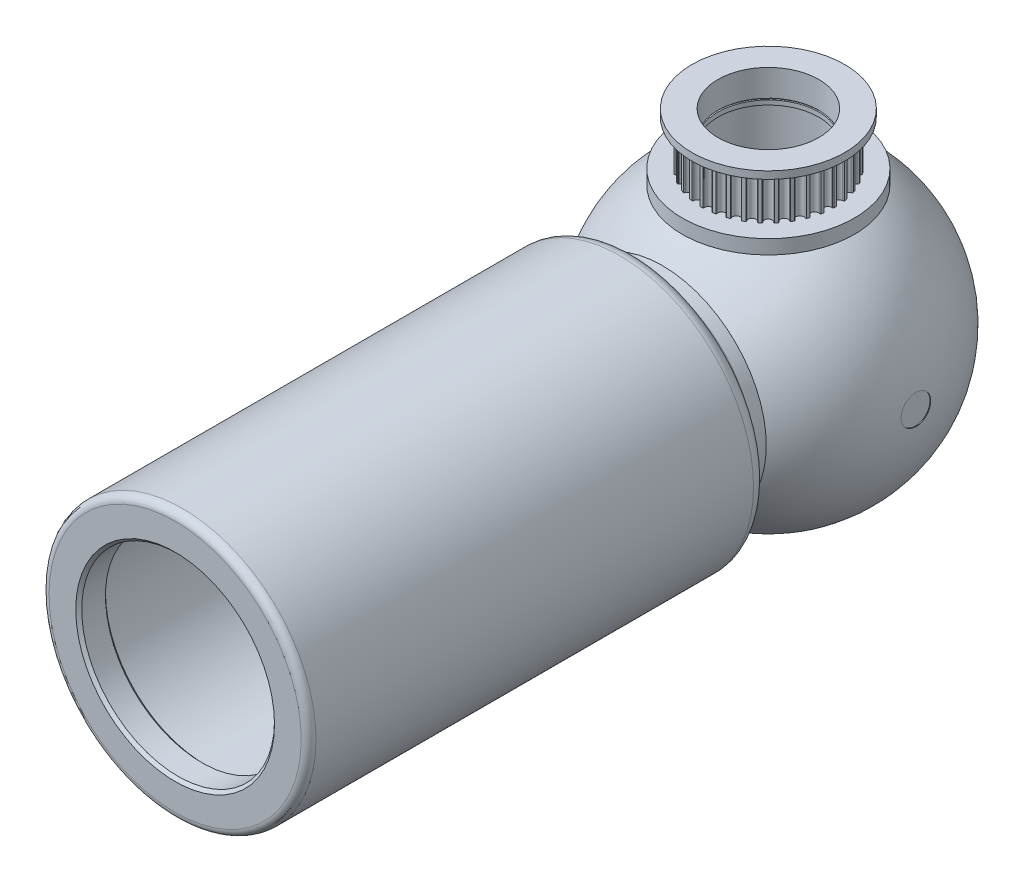
from build123d import *

# Parameters (mm, degrees)
SKETCH4_R           = 45.150000000000006
EXTRUDE3_DEPTH      = 30
EXTRUDE4_DEPTH      = 30
CIRPATTERN1_COUNT   = 36
SKETCH5_R           = 51.5
EXTRUDE5_DEPTH      = 5
EXTRUDE6_REACH      = 258.665
EXTRUDE6_END_RADIUS = 100
SKETCH11_R          = 70.00000000000001
SKETCH12_R          = 90
EXTRUDE7_DEPTH      = 10
EXTRUDE8_START      = 300
SKETCH13_R          = 90.00000000000001
SKETCH13_R_2        = 75.00000000000001
EXTRUDE8_DEPTH      = 300
FILLET1_R           = 10
SKETCH14_R          = 75.00000000000004
SKETCH14_R_2        = 65
EXTRUDE9_DEPTH      = 20
FILLET2_R           = 5
CHAMFER2_SIZE       = 2
SKETCH15_R          = 10.000000000000004
CUT_EXTRUDE1_DEPTH  = 1


with BuildPart() as part:
    # Sketch1 → Revolve1 (revolve)
    with BuildSketch(Plane.XY, mode=Mode.PRIVATE) as revolve1_sk:
        with BuildLine():
            Line((57.99999999999998, 81.46164741766522), (57.99999999999998, 91.00445492000001))
            Line((57.99999999999998, 91.00445492000001), (-2.339e-14, 91.00445492))
            Line((-2.339e-14, 91.00445492), (2.204e-14, -100))
            ThreePointArc((2.204e-14, -100), (95.25272894192199, -30.44532195784334), (57.99999999999998, 81.46164741766522))
        make_face()
    revolve(revolve1_sk.sketch.rotate(Axis((-2.339e-14, 91.00445492, 0), (2.4e-16, -1, 0)), 180), axis=Axis((-2.339e-14, 91.00445492, 0), (2.4e-16, -1, 0)))

    # Sketch4 → Extrude3 (add)
    with BuildSketch(Plane(origin=(-2.165e-14, 91.00445491999999, 0), x_dir=(1, 2.4e-16, 0), z_dir=(-2.4e-16, 1, 0))):
        with Locations(Location((0, 0, 0), (0, 0, 180))):
            Circle(SKETCH4_R)
    extrude(amount=EXTRUDE3_DEPTH)

    # Sketch3 → Extrude4 (cut)
    with BuildSketch(Plane(origin=(-2.165e-14, 91.00445491999999, 0), x_dir=(1, 2.4e-16, 0), z_dir=(-2.4e-16, 1, 0))):
        with BuildLine():
            Line((-1.2656108048172179, 44.394558922616696), (-1.2821062891524753, 43.922190055167896))
            ThreePointArc((-1.2821062891524753, 43.922190055167896), (-3.6265504557300683, 41.45166138759755), (-6.364380048477421, 43.477548716291686))
            Line((-6.364380048477421, 43.477548716291686), (-6.4626509223595505, 43.93987682844231))
            ThreePointArc((-6.4626509223595505, 43.93987682844231), (-6.785899963415481, 44.421956093074286), (-7.352628199224167, 44.54729350436426))
            ThreePointArc((-7.352628199224167, 44.54729350436426), (-3.935081785056771, 44.97819061884231), (-0.4946310814146013, 45.14729050666605))
            ThreePointArc((-0.4946310814146013, 45.14729050666605), (-1.0309848288259285, 44.92544592690464), (-1.2656108048172179, 44.394558922616696))
        make_face()
    extrude4 = extrude(amount=EXTRUDE4_DEPTH, mode=Mode.SUBTRACT)

    # CirPattern1: Extrude4 ×36 about axis
    cirpattern1_axis = Axis((0.00928462633456735, 0, 0.10612376461600313), (0, 1, 0))
    for i in range(1, CIRPATTERN1_COUNT):
        add(extrude4.rotate(cirpattern1_axis, i * 360 / CIRPATTERN1_COUNT), mode=Mode.SUBTRACT)

    # Sketch5 → Extrude5 (add)
    with BuildSketch(Plane(origin=(-2.878e-14, 121.00445491999999, 0), x_dir=(1, 2.4e-16, 0), z_dir=(-2.4e-16, 1, 0))):
        with Locations(Location((0, 0, 0), (0, 0, 180))):
            Circle(SKETCH5_R)
    extrude(amount=EXTRUDE5_DEPTH)

    # Sketch9 → Cut-Revolve1 (revolve, cut)
    with BuildSketch(Plane(origin=(0, 0, 0), x_dir=(0, 0, -1), z_dir=(1, 0, 0))):
        Polygon((0, -73.74957626996917), (30.999999999999993, -73.74957626996917), (30.999999999999993, -71.74957626996917), (33.99999999999999, -71.74957626996917), (33.99999999999999, -56.74957626996918), (35.00000000000001, -56.7495762699692), (35.00000000000001, -55.7495762699692), (34.00000000000001, -55.7495762699692), (34.000000000000014, -52.74957626996919), (36, -52.74957626996919), (36, 104.00445491999997), (34.000000000000014, 104.00445491999997), (34.00000000000001, 107.00445491999997), (35.00000000000001, 107.00445491999997), (35.00000000000001, 108.00445491999997), (34.00000000000001, 108.00445491999997), (34.00000000000001, 126.00445491999999), (0, 126.00445491999999), align=None)
    revolve(axis=Axis((0, -73.74957626996917, 0), (0, 1, 0)), mode=Mode.SUBTRACT)

    # Extrude6: up to this sphere (the profile starts outside it)
    extrude6_end = Location((0, 0, 0)) * Sphere(EXTRUDE6_END_RADIUS, mode=Mode.PRIVATE)
    # Sketch11 → Extrude6 (add, up to the surface)
    with BuildSketch(Plane.XY.offset(100), mode=Mode.PRIVATE) as extrude6_sk1:
        Circle(SKETCH11_R)
    extrude6_tool1 = extrude(extrude6_sk1.sketch, amount=-EXTRUDE6_REACH, mode=Mode.PRIVATE) - extrude6_end
    add(extrude6_tool1.solids().sort_by_distance((0, 0, 100))[0])

    # Sketch12 → Extrude7 (add)
    with BuildSketch(Plane.XY.offset(100)):
        Circle(SKETCH12_R)
    extrude(amount=-EXTRUDE7_DEPTH)

    # Sketch13 → Extrude8 (add)
    with BuildSketch(Plane.XY.offset(100).offset(EXTRUDE8_START)):
        Circle(SKETCH13_R)
        Circle(SKETCH13_R_2, mode=Mode.SUBTRACT)
    extrude(amount=-EXTRUDE8_DEPTH)

    # Fillet1
    fillet1_edges = [part.edges().sort_by_distance(p)[0] for p in [
        (-70.00000000000001, 8.57e-15, 90),
        (-90, 1.102e-14, 90),
    ]]
    fillet(fillet1_edges, radius=FILLET1_R - 0.0001)  # a hair under: the kernel refuses the full size

    # Sketch14 → Extrude9 (add)
    with BuildSketch(Plane.XY.offset(400)):
        Circle(SKETCH14_R)
        Circle(SKETCH14_R_2, mode=Mode.SUBTRACT)
    extrude(amount=-EXTRUDE9_DEPTH)

    # Fillet2
    fillet2_edges = [part.edges().sort_by_distance(p)[0] for p in [
        (-90.00000000000001, 1.102e-14, 400),
    ]]
    fillet(fillet2_edges, radius=FILLET2_R)

    # Chamfer2
    chamfer2_edges = [part.edges().sort_by_distance(p)[0] for p in [
        (-65, 7.96e-15, 380),
        (-65, 7.96e-15, 400),
    ]]
    chamfer(chamfer2_edges, length=CHAMFER2_SIZE)

    # Sketch15 → Cut-Extrude1 (cut)
    with BuildSketch(Plane(origin=(100, 0, 0), x_dir=(0, 0, -1), z_dir=(1, 0, 0))):
        Circle(SKETCH15_R)
    extrude(amount=-CUT_EXTRUDE1_DEPTH, mode=Mode.SUBTRACT)


solid = part.part
